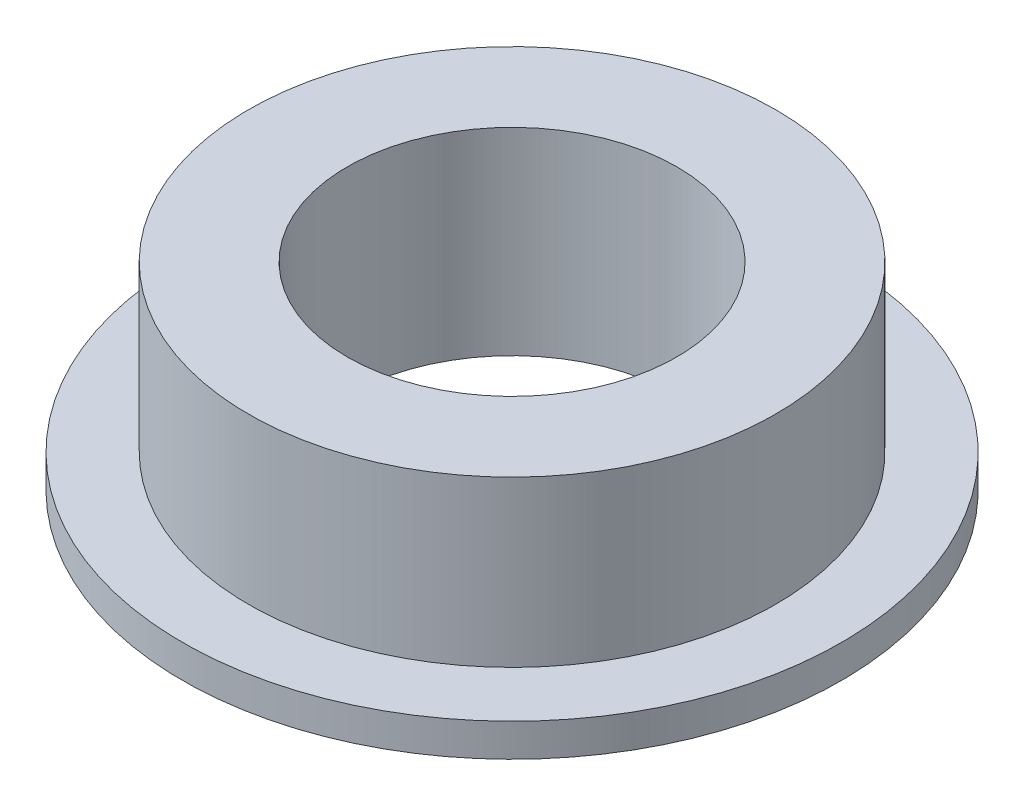
from build123d import *

# Parameters (mm, degrees)
SKETCH1_R           = 12.7
SKETCH1_R_2         = 7.9375
BOSS_EXTRUDE1_DEPTH = 4.7625
BOSS_EXTRUDE2_START = -1.5875
SKETCH2_R           = 15.875
SKETCH2_R_2         = 12.7
BOSS_EXTRUDE2_DEPTH = 1.5875


with BuildPart() as part:
    # Sketch1 → Boss-Extrude1 (new, symmetric)
    with BuildSketch(Plane(origin=(0, 0, 0), x_dir=(1, 0, 0), z_dir=(0, 1, 0))):
        Circle(SKETCH1_R)
        Circle(SKETCH1_R_2, mode=Mode.SUBTRACT)
    extrude(amount=BOSS_EXTRUDE1_DEPTH, both=True)

    # Sketch2 → Boss-Extrude2 (add)
    with BuildSketch(Plane.XZ.offset(4.7625).offset(BOSS_EXTRUDE2_START)):
        Circle(SKETCH2_R)
        Circle(SKETCH2_R_2, mode=Mode.SUBTRACT)
    extrude(amount=BOSS_EXTRUDE2_DEPTH)


solid = part.part
